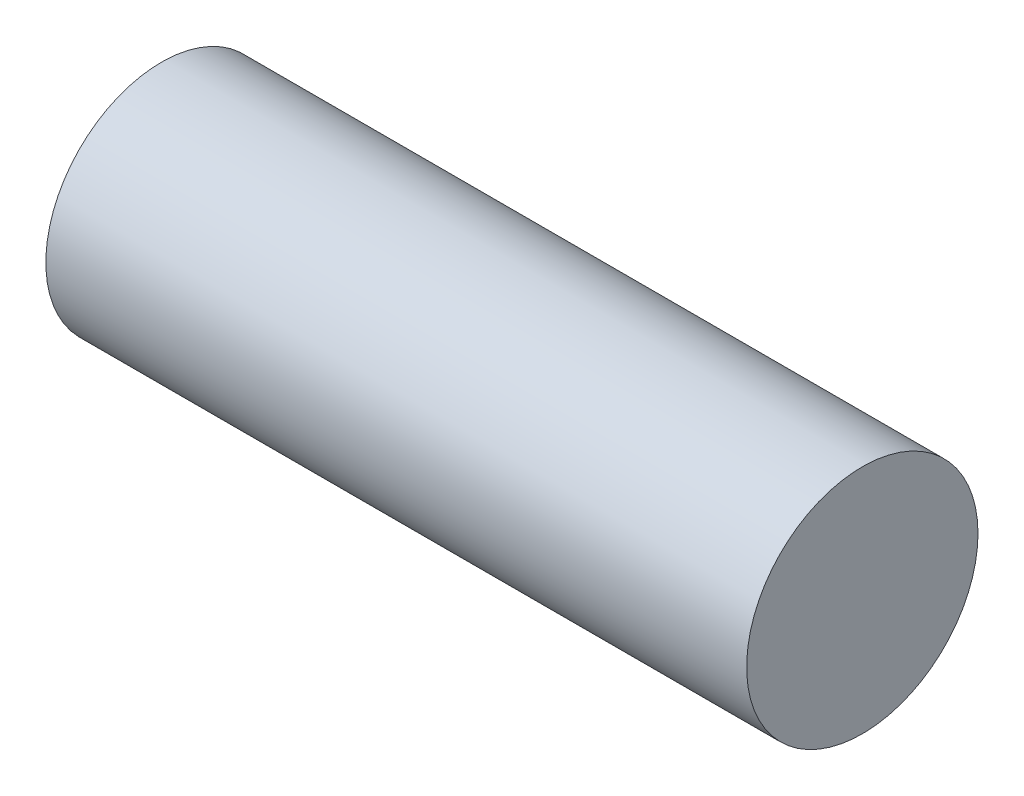
from build123d import *

# Parameters (mm, degrees)
SKETCH1_R           = 6
BOSS_EXTRUDE1_DEPTH = 36.35


with BuildPart() as part:
    # Sketch1 → Boss-Extrude1 (new body)
    with BuildSketch(Plane(origin=(0, 0, 0), x_dir=(0, 0, -1), z_dir=(1, 0, 0))):
        Circle(SKETCH1_R)
    extrude(amount=BOSS_EXTRUDE1_DEPTH)


solid = part.part
